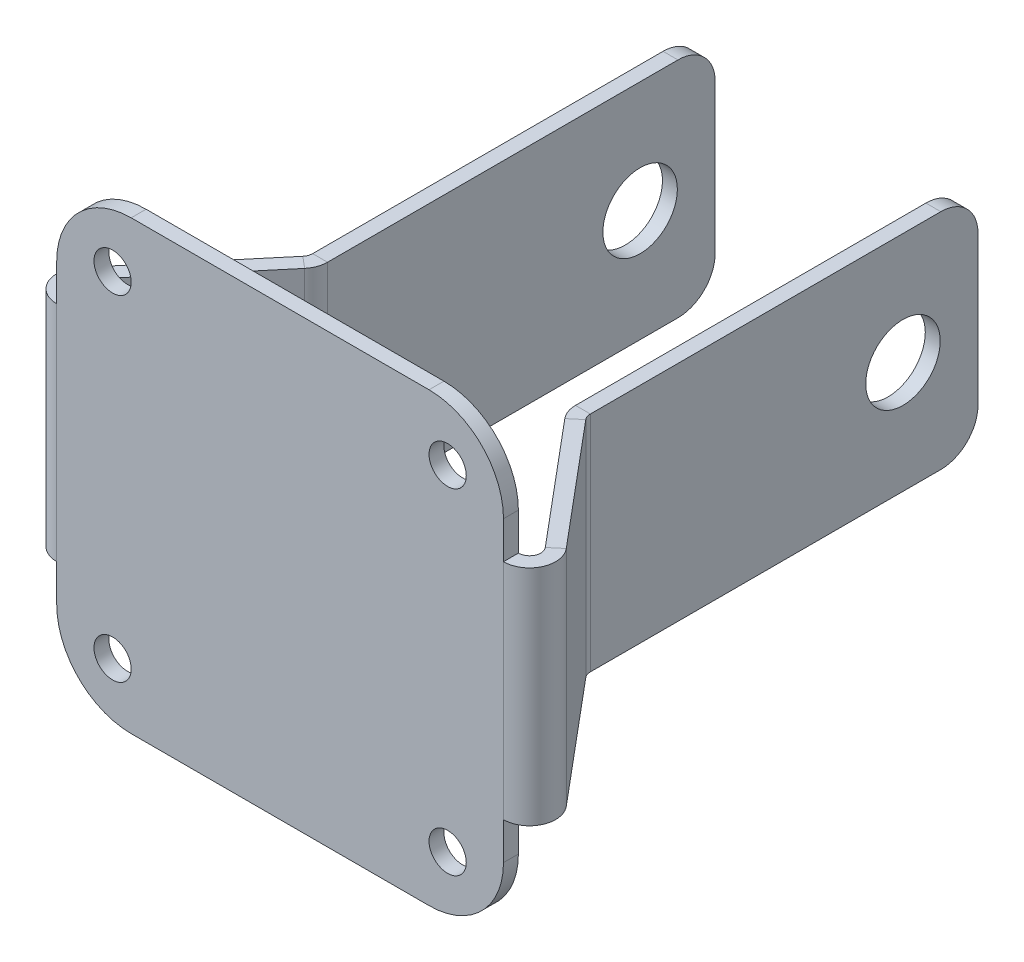
from build123d import *

# Parameters (mm, degrees)
SCHIZZO1_R                           = 5
BASE_FLANGIA1_DEPTH                  = 4
BORDO_FLANGIA1_DEPTH                 = 60
BORDO_FLANGIA1_BEND_DEPTH            = 60
PIEGATURA_START                      = -60
PIEGATURA_DELLO_SCHIZZO1_DEPTH       = 120
PIEGATURA_DELLO_SCHIZZO1_2_DEPTH     = 30
PIEGATURA_START_2                    = 30
PIEGATURA_DELLO_SCHIZZO1_3_DEPTH     = 30
PIEGATURA_START_3                    = -30
PIEGATURA_DELLO_SCHIZZO1_4_OUTLINE_W = 4
PIEGATURA_DELLO_SCHIZZO1_4_OUTLINE_H = 43.334436945
PIEGATURA_DELLO_SCHIZZO1_4_DEPTH     = 60
PIEGATURA_START_4                    = -40
PIEGATURA_DELLO_SCHIZZO1_5_DEPTH     = 79.9999999
PIEGATURA_DELLO_SCHIZZO1_6_DEPTH     = 120
PIEGATURA_START_5                    = -33.183921824
PIEGATURA_DELLO_SCHIZZO1_7_OUTLINE_R = 5
PIEGATURA_DELLO_SCHIZZO1_7_DEPTH     = 4
PIEGATURA_DELLO_SCHIZZO2_DEPTH       = 120
PIEGATURA_DELLO_SCHIZZO2_2_DEPTH     = 30
PIEGATURA_DELLO_SCHIZZO2_3_DEPTH     = 30
PIEGATURA_DELLO_SCHIZZO2_4_DEPTH     = 60
PIEGATURA_DELLO_SCHIZZO2_5_DEPTH     = 79.9999999
PIEGATURA_DELLO_SCHIZZO2_6_DEPTH     = 120
PIEGATURA_START_6                    = 41.644539399
PIEGATURA_DELLO_SCHIZZO2_7_OUTLINE_R = 5
PIEGATURA_DELLO_SCHIZZO2_7_DEPTH     = 4
SCHIZZO25_W                          = 4
SCHIZZO25_H                          = 60
ESTRUSIONE_ESTRUSIONE1_DEPTH         = 57.18
TAGLIO_ESTRUSIONE1_DEPTH             = 75


with BuildPart() as part:
    # Base-Flangia1: sheet metal written as solids
    # Schizzo1 → Base-Flangia1 (new body)
    with BuildSketch(Plane.XY):
        with BuildLine():
            Line((40, -60), (-40, -60))
            ThreePointArc((-40, -60), (-54.142135624, -54.142135624), (-60, -40))
            Line((-60, -40), (-60, 40))
            ThreePointArc((-60, 40), (-54.142135624, 54.142135624), (-40, 60))
            Line((-40, 60), (40, 60))
            ThreePointArc((40, 60), (54.142135624, 54.142135624), (60, 40))
            Line((60, 40), (60, -40))
            ThreePointArc((60, -40), (54.142135624, -54.142135624), (40, -60))
        make_face()
        with Locations((-45, 45)):
            Circle(SCHIZZO1_R, mode=Mode.SUBTRACT)
        with Locations((45, 45)):
            Circle(SCHIZZO1_R, mode=Mode.SUBTRACT)
        with Locations((-45, -45)):
            Circle(SCHIZZO1_R, mode=Mode.SUBTRACT)
        with Locations((45, -45)):
            Circle(SCHIZZO1_R, mode=Mode.SUBTRACT)
    extrude(amount=-BASE_FLANGIA1_DEPTH)

    # Bordo-Flangia1: sheet metal written as solids
    # Bordo-Flangia1 section (on a plane across the edge) → Bordo-Flangia1 (add)
    with BuildSketch(Plane(origin=(-66.433520762, -30, -4), x_dir=(0.7660444431189795, 5.514832408348335e-15, 0.6427876096865378), z_dir=(0, 1, 0))):
        with BuildLine():
            Line((-4, 6.433520762), (-4, 99.433520762))
            Line((-4, 99.433520762), (0, 99.433520762))
            Line((0, 99.433520762), (0, 6.433520762))
            ThreePointArc((0, 6.433520762), (1.732145215, 3.7145974), (4.928362829, 4.135387432))
            Line((4.928362829, 4.135387432), (7.499513268, 1.07120966))
            ThreePointArc((7.499513268, 1.07120966), (0.041672168, 0.089366252), (-4, 6.433520762))
        make_face()
    extrude(amount=BORDO_FLANGIA1_DEPTH)

    # Bordo-Flangia1 section 2 (on a plane across the edge) → Bordo-Flangia1 bend (add)
    with BuildSketch(Plane(origin=(66.433520762, 30, -4), x_dir=(-0.7660444431189795, 0, 0.6427876096865378), z_dir=(0, -1, 0))):
        with BuildLine():
            Line((-4, 6.433520762), (-4, 99.433520762))
            Line((-4, 99.433520762), (0, 99.433520762))
            Line((0, 99.433520762), (0, 6.433520762))
            ThreePointArc((0, 6.433520762), (1.732145215, 3.7145974), (4.928362829, 4.135387432))
            Line((4.928362829, 4.135387432), (7.499513268, 1.07120966))
            ThreePointArc((7.499513268, 1.07120966), (0.041672168, 0.089366252), (-4, 6.433520762))
        make_face()
    extrude(amount=BORDO_FLANGIA1_BEND_DEPTH)

    # Piegatura dello schizzo1: read off the stored shape, not the designer's step
    # Piegatura dello schizzo1 outline → Piegatura dello schizzo1 (cut)
    with BuildSketch(Plane(origin=(0, 0, 0), x_dir=(1, 0, 0), z_dir=(0, 1, 0)).offset(PIEGATURA_START)):
        with BuildLine():
            Line((-36.841112184, 41.814650875), (-40.46038277, 41.17647582))
            Line((-40.46038277, 41.17647582), (-62.777646918, 14.579796095))
            Line((-62.777646918, 14.579796095), (-59.713469145, 12.008645656))
            Line((-59.713469145, 12.008645656), (-32.694338326, 44.208791879))
            ThreePointArc((-32.694338326, 44.208791879), (-34.556649428, 42.64612732), (-36.841112184, 41.814650875))
        make_face()
        with BuildLine():
            Line((-62.284619584, 8.944467884), (-65.348797357, 11.515618323))
            Line((-65.348797357, 11.515618323), (-65.362311102, 11.499513268))
            ThreePointArc((-65.362311102, 11.499513268), (-66.344154509, 4.041672168), (-60, 0))
            Line((-60, 0), (-51.62501785, 0))
            Line((-51.62501785, 0), (-56.39203222, 4))
            Line((-56.39203222, 4), (-60, 4))
            ThreePointArc((-60, 4), (-62.718923361, 5.732145215), (-62.298133329, 8.928362829))
            Line((-62.298133329, 8.928362829), (-62.284619584, 8.944467884))
        make_face()
        Polygon((16.687147766, 4), (-50.169136913, 4), (-45.402122543, 0), (16.687147765, 0), align=None)
        with BuildLine():
            Line((60, 4), (20.687147766, 4))
            Line((20.687147766, 4), (20.687147765, 0))
            Line((20.687147765, 0), (60, 0))
            ThreePointArc((60, 0), (66.344154509, 4.041672168), (65.362311102, 11.499513268))
            Line((65.362311102, 11.499513268), (5.583063401, 82.741646478))
            Line((5.583063401, 82.741646478), (2.518885629, 80.170496039))
            Line((2.518885629, 80.170496039), (62.298133329, 8.928362829))
            ThreePointArc((62.298133329, 8.928362829), (62.718923361, 5.732145215), (60, 4))
        make_face()
    extrude(amount=PIEGATURA_DELLO_SCHIZZO1_DEPTH, mode=Mode.SUBTRACT)

    # Piegatura dello schizzo1 2 outline → Piegatura dello schizzo1 2 (cut)
    with BuildSketch(Plane(origin=(0, 0, 0), x_dir=(1, 0, 0), z_dir=(0, 1, 0)).offset(PIEGATURA_START)):
        Polygon((20.687147766, 4), (16.687147766, 4), (16.687147765, 0), (20.687147765, 0), align=None)
    extrude(amount=PIEGATURA_DELLO_SCHIZZO1_2_DEPTH, mode=Mode.SUBTRACT)

    # Piegatura dello schizzo1 3 outline → Piegatura dello schizzo1 3 (cut)
    with BuildSketch(Plane(origin=(0, 0, 0), x_dir=(1, 0, 0), z_dir=(0, 1, 0)).offset(PIEGATURA_START_2)):
        Polygon((20.687147766, 4), (16.687147766, 4), (16.687147765, 0), (20.687147765, 0), align=None)
    extrude(amount=PIEGATURA_DELLO_SCHIZZO1_3_DEPTH, mode=Mode.SUBTRACT)

    # Piegatura dello schizzo1 4 outline → Piegatura dello schizzo1 4 (add)
    with BuildSketch(Plane(origin=(0, 0, 0), x_dir=(1, 0, 0), z_dir=(0, 1, 0)).offset(PIEGATURA_START_3)):
        with BuildLine():
            ThreePointArc((-80.166548238, 29.170816779), (-81.135962887, 32.245407244), (-78.759129941, 34.423373367))
            Line((-78.759129941, 34.423373367), (-40.46038277, 41.17647582))
            Line((-40.46038277, 41.17647582), (-35.758516099, 46.779942317))
            ThreePointArc((-35.758516099, 46.779942317), (-36.556649428, 46.110228935), (-37.535704895, 45.753881887))
            Line((-37.535704895, 45.753881887), (-79.453722652, 38.362604379))
            ThreePointArc((-79.453722652, 38.362604379), (-84.999666192, 33.280683424), (-82.737698676, 26.106639007))
            Line((-82.737698676, 26.106639007), (-65.348797357, 11.515618323))
            Line((-65.348797357, 11.515618323), (-62.777646918, 14.579796095))
            Line((-62.777646918, 14.579796095), (-80.166548238, 29.170816779))
        make_face()
        Polygon((-50.169136913, 4), (-59.713469145, 12.008645656), (-62.284619584, 8.944467884), (-56.39203222, 4), align=None)
        with BuildLine():
            Line((11.758784936, -47.963696384), (-45.402122543, 0))
            Line((-45.402122543, 0), (-51.62501785, 0))
            Line((-51.62501785, 0), (9.187634497, -51.027874157))
            ThreePointArc((9.187634497, -51.027874157), (16.645475597, -52.009717564), (20.687147765, -45.665563055))
            Line((20.687147765, -45.665563055), (20.687147765, 0))
            Line((20.687147765, 0), (16.687147765, 0))
            Line((16.687147765, 0), (16.687147765, -45.665563055))
            ThreePointArc((16.687147765, -45.665563055), (14.95500255, -48.384486416), (11.758784936, -47.963696384))
        make_face()
        with Locations((18.687147766, 25.667218473)):
            Rectangle(PIEGATURA_DELLO_SCHIZZO1_4_OUTLINE_W, PIEGATURA_DELLO_SCHIZZO1_4_OUTLINE_H)
    extrude(amount=PIEGATURA_DELLO_SCHIZZO1_4_DEPTH)

    # Piegatura dello schizzo1 5 outline → Piegatura dello schizzo1 5 (add)
    with BuildSketch(Plane(origin=(0, 0, 0), x_dir=(1, 0, 0), z_dir=(0, 1, 0)).offset(PIEGATURA_START_4)):
        Polygon((-80.166548238, 29.170816779), (-82.737698676, 26.106639007), (-56.39203222, 4), (-50.169136913, 4), align=None)
        Polygon((11.758784936, -47.963696384), (-45.402122543, 0), (-51.62501785, 0), (9.187634497, -51.027874157), align=None)
    extrude(amount=PIEGATURA_DELLO_SCHIZZO1_5_DEPTH)

    # Piegatura dello schizzo1 6 outline → Piegatura dello schizzo1 6 (add)
    with BuildSketch(Plane(origin=(0, 0, 0), x_dir=(1, 0, 0), z_dir=(0, 1, 0)).offset(PIEGATURA_START)):
        Polygon((-62.777646918, 14.579796095), (-65.348797357, 11.515618323), (-51.62501785, 0), (-45.402122543, 0), align=None)
    extrude(amount=PIEGATURA_DELLO_SCHIZZO1_6_DEPTH)

    # Piegatura dello schizzo1 7 outline → Piegatura dello schizzo1 7 (add)
    with BuildSketch(Plane(origin=(0, 0, 0), x_dir=(0.7660444431125499, 0, 0.6427876096942), z_dir=(0.6427876096942, 0, -0.76604444311255)).offset(PIEGATURA_START_5)):
        with BuildLine():
            Line((-80.161778391, 40), (-80.161778391, -40))
            ThreePointArc((-80.161778391, -40), (-74.303914015, -54.142135624), (-60.161778391, -60))
            Line((-60.161778391, -60), (19.838221609, -60))
            ThreePointArc((19.838221609, -60), (33.980357233, -54.142135624), (39.838221609, -40))
            Line((39.838221609, -40), (39.838221609, 40))
            ThreePointArc((39.838221609, 40), (33.980357233, 54.142135624), (19.838221609, 60))
            Line((19.838221609, 60), (-60.161778391, 60))
            ThreePointArc((-60.161778391, 60), (-74.303914015, 54.142135624), (-80.161778391, 40))
        make_face()
        with Locations((-65.161778391, -45)):
            Circle(PIEGATURA_DELLO_SCHIZZO1_7_OUTLINE_R, mode=Mode.SUBTRACT)
        with Locations((24.838221609, -45)):
            Circle(PIEGATURA_DELLO_SCHIZZO1_7_OUTLINE_R, mode=Mode.SUBTRACT)
        with Locations((-65.161778391, 45)):
            Circle(PIEGATURA_DELLO_SCHIZZO1_7_OUTLINE_R, mode=Mode.SUBTRACT)
        with Locations((24.838221609, 45)):
            Circle(PIEGATURA_DELLO_SCHIZZO1_7_OUTLINE_R, mode=Mode.SUBTRACT)
    extrude(amount=PIEGATURA_DELLO_SCHIZZO1_7_DEPTH)

    # Piegatura dello schizzo2: read off the stored shape, not the designer's step
    # Piegatura dello schizzo2 outline → Piegatura dello schizzo2 (cut)
    with BuildSketch(Plane(origin=(0, 0, 0), x_dir=(1, 0, 0), z_dir=(0, 1, 0)).offset(PIEGATURA_START)):
        with BuildLine():
            Line((20.687147765, -41.6445394), (20.687147765, -6.925039813))
            Line((20.687147765, -6.925039813), (18.324836664, -4.109747071))
            ThreePointArc((18.324836664, -4.109747071), (17.10929942, -2.004374806), (16.687147765, 0.389766197))
            Line((16.687147765, 0.389766197), (16.687147765, -41.6445394))
            Line((16.687147765, -41.6445394), (20.687147765, -41.6445394))
        make_face()
        with BuildLine():
            Line((20.687147765, -45.665563055), (20.687147765, -45.6445394))
            Line((20.687147765, -45.6445394), (16.687147765, -45.6445394))
            Line((16.687147765, -45.6445394), (16.687147765, -45.665563055))
            ThreePointArc((16.687147765, -45.665563055), (14.95500255, -48.384486416), (11.758784936, -47.963696384))
            Line((11.758784936, -47.963696384), (8.994921268, -45.6445394))
            Line((8.994921268, -45.6445394), (2.77202596, -45.6445394))
            Line((2.77202596, -45.6445394), (9.187634497, -51.027874157))
            ThreePointArc((9.187634497, -51.027874157), (16.645475597, -52.009717564), (20.687147765, -45.665563055))
        make_face()
        with BuildLine():
            Line((-1.99498841, -41.6445394), (4.227906898, -41.6445394))
            Line((4.227906898, -41.6445394), (-49.913655163, 3.785625357))
            Line((-49.913655163, 3.785625357), (-49.913655163, 0.389766198))
            ThreePointArc((-49.913655163, 0.389766198), (-49.963662862, -0.445462526), (-50.112971454, -1.268757573))
            Line((-50.112971454, -1.268757573), (-1.99498841, -41.6445394))
        make_face()
        with BuildLine():
            Line((-49.913655163, 43.571315289), (-49.913655163, 39.509608841))
            Line((-49.913655163, 39.509608841), (-36.841112184, 41.814650875))
            ThreePointArc((-36.841112184, 41.814650875), (-34.556649428, 42.64612732), (-32.694338326, 44.208791879))
            Line((-32.694338326, 44.208791879), (-2.518885629, 80.170496039))
            Line((-2.518885629, 80.170496039), (-5.583063401, 82.741646478))
            Line((-5.583063401, 82.741646478), (-35.758516099, 46.779942317))
            ThreePointArc((-35.758516099, 46.779942317), (-36.556649428, 46.110228935), (-37.535704895, 45.753881887))
            Line((-37.535704895, 45.753881887), (-49.913655163, 43.571315289))
        make_face()
        with BuildLine():
            Line((-53.913655163, 1.920394725), (-53.913655163, 7.142023882))
            Line((-53.913655163, 7.142023882), (-80.166548238, 29.170816779))
            ThreePointArc((-80.166548238, 29.170816779), (-81.135962887, 32.245407244), (-78.759129941, 34.423373367))
            Line((-78.759129941, 34.423373367), (-53.913655163, 38.804300919))
            Line((-53.913655163, 38.804300919), (-53.913655163, 42.866007366))
            Line((-53.913655163, 42.866007366), (-79.453722652, 38.362604379))
            ThreePointArc((-79.453722652, 38.362604379), (-84.999666192, 33.280683424), (-82.737698676, 26.106639007))
            Line((-82.737698676, 26.106639007), (-53.913655163, 1.920394725))
        make_face()
    extrude(amount=PIEGATURA_DELLO_SCHIZZO2_DEPTH, mode=Mode.SUBTRACT)

    # Piegatura dello schizzo2 2 outline → Piegatura dello schizzo2 2 (cut)
    with BuildSketch(Plane(origin=(0, 0, 0), x_dir=(1, 0, 0), z_dir=(0, 1, 0)).offset(PIEGATURA_START)):
        with BuildLine():
            Line((-49.913655163, 0.389766198), (-49.913655163, 3.785625357))
            Line((-49.913655163, 3.785625357), (-53.913655163, 7.142023882))
            Line((-53.913655163, 7.142023882), (-53.913655163, 1.920394725))
            Line((-53.913655163, 1.920394725), (-50.112971454, -1.268757573))
            ThreePointArc((-50.112971454, -1.268757573), (-49.963662862, -0.445462526), (-49.913655163, 0.389766198))
        make_face()
    extrude(amount=PIEGATURA_DELLO_SCHIZZO2_2_DEPTH, mode=Mode.SUBTRACT)

    # Piegatura dello schizzo2 3 outline → Piegatura dello schizzo2 3 (cut)
    with BuildSketch(Plane(origin=(0, 0, 0), x_dir=(1, 0, 0), z_dir=(0, 1, 0)).offset(PIEGATURA_START_2)):
        with BuildLine():
            Line((-49.913655163, 0.389766198), (-49.913655163, 3.785625357))
            Line((-49.913655163, 3.785625357), (-53.913655163, 7.142023882))
            Line((-53.913655163, 7.142023882), (-53.913655163, 1.920394725))
            Line((-53.913655163, 1.920394725), (-50.112971454, -1.268757573))
            ThreePointArc((-50.112971454, -1.268757573), (-49.963662862, -0.445462526), (-49.913655163, 0.389766198))
        make_face()
    extrude(amount=PIEGATURA_DELLO_SCHIZZO2_3_DEPTH, mode=Mode.SUBTRACT)

    # Piegatura dello schizzo2 4 outline → Piegatura dello schizzo2 4 (add)
    with BuildSketch(Plane(origin=(0, 0, 0), x_dir=(1, 0, 0), z_dir=(0, 1, 0)).offset(PIEGATURA_START_3)):
        with BuildLine():
            Line((48.749057403, -34.145026132), (21.389014436, -1.538596632))
            ThreePointArc((21.389014436, -1.538596632), (20.868069903, -0.636294233), (20.687147765, 0.389766197))
            Line((20.687147765, 0.389766197), (20.687147765, -6.925039813))
            Line((20.687147765, -6.925039813), (45.68487963, -36.716176571))
            ThreePointArc((45.68487963, -36.716176571), (46.105669662, -39.912394185), (43.386746301, -41.6445394))
            Line((43.386746301, -41.6445394), (20.687147765, -41.6445394))
            Line((20.687147765, -41.6445394), (20.687147765, -45.6445394))
            Line((20.687147765, -45.6445394), (43.386746301, -45.6445394))
            ThreePointArc((43.386746301, -45.6445394), (49.73090081, -41.602867232), (48.749057403, -34.145026132))
        make_face()
        Polygon((8.994921268, -45.6445394), (16.687147765, -45.6445394), (16.687147765, -41.6445394), (4.227906898, -41.6445394), align=None)
        with BuildLine():
            Line((-76.613253699, -45.644539399), (2.77202596, -45.6445394))
            Line((2.77202596, -45.6445394), (-1.99498841, -41.6445394))
            Line((-1.99498841, -41.6445394), (-76.613253699, -41.644539399))
            ThreePointArc((-76.613253699, -41.644539399), (-79.33217706, -39.912394184), (-78.911387028, -36.71617657))
            Line((-78.911387028, -36.71617657), (-51.551344061, -4.10974707))
            ThreePointArc((-51.551344061, -4.10974707), (-50.668463731, -2.772129433), (-50.112971454, -1.268757573))
            Line((-50.112971454, -1.268757573), (-53.913655163, 1.920394725))
            Line((-53.913655163, 1.920394725), (-53.913655163, 0.389766198))
            ThreePointArc((-53.913655163, 0.389766198), (-54.0945773, -0.636294232), (-54.615521833, -1.538596631))
            Line((-54.615521833, -1.538596631), (-81.975564801, -34.145026131))
            ThreePointArc((-81.975564801, -34.145026131), (-82.957408208, -41.602867231), (-76.613253699, -45.644539399))
        make_face()
        Polygon((-53.913655163, 7.142023882), (-49.913655163, 3.785625357), (-49.913655163, 39.509608841), (-53.913655163, 38.804300919), align=None)
        Polygon((-53.913655163, 42.866007366), (-49.913655163, 43.571315289), (-49.913655163, 47.334436946), (-53.913655163, 47.334436946), align=None)
    extrude(amount=PIEGATURA_DELLO_SCHIZZO2_4_DEPTH)

    # Piegatura dello schizzo2 5 outline → Piegatura dello schizzo2 5 (add)
    with BuildSketch(Plane(origin=(0, 0, 0), x_dir=(1, 0, 0), z_dir=(0, 1, 0)).offset(PIEGATURA_START_4)):
        Polygon((43.386746301, -45.6445394), (43.386746301, -41.6445394), (4.227906898, -41.6445394), (8.994921268, -45.6445394), align=None)
        Polygon((-76.613253699, -45.644539399), (2.77202596, -45.6445394), (-1.99498841, -41.6445394), (-76.613253699, -41.644539399), align=None)
    extrude(amount=PIEGATURA_DELLO_SCHIZZO2_5_DEPTH)

    # Piegatura dello schizzo2 6 outline → Piegatura dello schizzo2 6 (add)
    with BuildSketch(Plane(origin=(0, 0, 0), x_dir=(1, 0, 0), z_dir=(0, 1, 0)).offset(PIEGATURA_START)):
        Polygon((20.687147765, -45.6445394), (20.687147765, -41.6445394), (-1.99498841, -41.6445394), (2.77202596, -45.6445394), align=None)
    extrude(amount=PIEGATURA_DELLO_SCHIZZO2_6_DEPTH)

    # Piegatura dello schizzo2 7 outline → Piegatura dello schizzo2 7 (add)
    with BuildSketch(Plane.XY.offset(PIEGATURA_START_6)):
        with BuildLine():
            ThreePointArc((-56.613253699, 60), (-70.755389322, 54.142135624), (-76.613253699, 40))
            Line((-76.613253699, 40), (-76.613253699, -40))
            ThreePointArc((-76.613253699, -40), (-70.755389322, -54.142135624), (-56.613253699, -60))
            Line((-56.613253699, -60), (23.386746301, -60))
            ThreePointArc((23.386746301, -60), (37.528881925, -54.142135624), (43.386746301, -40))
            Line((43.386746301, -40), (43.386746301, 40))
            ThreePointArc((43.386746301, 40), (37.528881925, 54.142135624), (23.386746301, 60))
            Line((23.386746301, 60), (-56.613253699, 60))
        make_face()
        with Locations((-61.613253699, -45)):
            Circle(PIEGATURA_DELLO_SCHIZZO2_7_OUTLINE_R, mode=Mode.SUBTRACT)
        with Locations((28.386746301, -45)):
            Circle(PIEGATURA_DELLO_SCHIZZO2_7_OUTLINE_R, mode=Mode.SUBTRACT)
        with Locations((-61.613253699, 45)):
            Circle(PIEGATURA_DELLO_SCHIZZO2_7_OUTLINE_R, mode=Mode.SUBTRACT)
        with Locations((28.386746301, 45)):
            Circle(PIEGATURA_DELLO_SCHIZZO2_7_OUTLINE_R, mode=Mode.SUBTRACT)
    extrude(amount=PIEGATURA_DELLO_SCHIZZO2_7_DEPTH)

    # Schizzo25 → Estrusione-Estrusione1 (add)
    with BuildSketch(Plane(origin=(0, 0, -47.334436945), x_dir=(-1.0, 0, -1.000266536266281e-11), z_dir=(1.000266536266281e-11, 4.012514324582407e-15, -1.0))):
        with Locations((-18.687147765, 0)):
            Rectangle(SCHIZZO25_W, SCHIZZO25_H)
        with Locations((51.913655163, 0)):
            Rectangle(SCHIZZO25_W, SCHIZZO25_H)
    extrude(amount=ESTRUSIONE_ESTRUSIONE1_DEPTH)

    # Schizzo26 → Taglio-Estrusione1 (cut)
    with BuildSketch(Plane(origin=(20.687147765, 0, 0), x_dir=(1.0002665362662809e-11, 0, -1.0), z_dir=(1.0, 2.37833744873856e-15, 1.0002665362662809e-11))):
        with BuildLine():
            ThreePointArc((74.355460601, 0), (84.355460601, -10), (94.355460601, 0))
            Line((94.355460601, 0), (74.355460601, 0))
        make_face()
        with BuildLine():
            Line((74.355460601, 0), (94.355460601, 0))
            ThreePointArc((94.355460601, 0), (84.355460601, 10), (74.355460601, 0))
        make_face()
        with BuildLine():
            Line((104.514436945, -30), (104.514436945, -20))
            ThreePointArc((104.514436945, -20), (101.585504757, -27.071067812), (94.514436945, -30))
            Line((94.514436945, -30), (104.514436945, -30))
        make_face()
        with BuildLine():
            ThreePointArc((94.514436945, 30), (101.585504757, 27.071067812), (104.514436945, 20))
            Line((104.514436945, 20), (104.514436945, 30))
            Line((104.514436945, 30), (94.514436945, 30))
        make_face()
    extrude(amount=-TAGLIO_ESTRUSIONE1_DEPTH, mode=Mode.SUBTRACT)


solid = part.part
